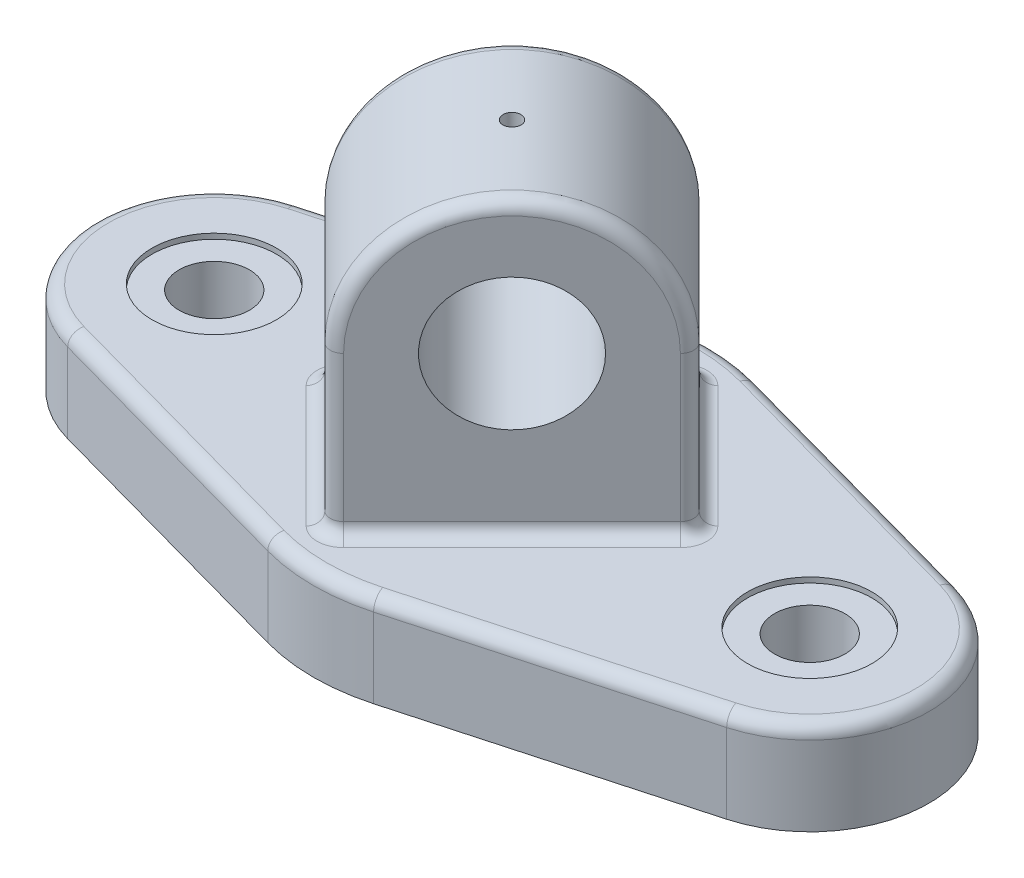
from build123d import *

# Parameters (mm, degrees)
BOSS_EXTRUDE1_DEPTH                                 = 17.78
CBORE_FOR_00_BINDING_HEAD_MACHINE_SCREW_D           = 13.4874
CBORE_FOR_00_BINDING_HEAD_MACHINE_SCREW_CBORE_D     = 23.876
CBORE_FOR_00_BINDING_HEAD_MACHINE_SCREW_CBORE_DEPTH = 1.016
BOSS_EXTRUDE3_DEPTH                                 = 19.05
SKETCH10_R                                          = 12.7
CUT_EXTRUDE1_DEPTH                                  = 19.05
F_29_0_136_DIAMETER_HOLE1_REACH                     = 117.235
F_29_0_136_DIAMETER_HOLE1_BORE_R                    = 1.7272
FILLET1_R                                           = 2.54
FILLET2_R                                           = 2.54
FILLET3_R                                           = 2.54
FILLET4_R                                           = 2.54
FILLET5_START                                       = -22.86
FILLET5_3_DEPTH                                     = 45.72


with BuildPart() as part:
    # Sketch1 → Boss-Extrude1 (new body)
    with BuildSketch(Plane(origin=(0, 0, 0), x_dir=(1, 0, 0), z_dir=(0, 1, 0))):
        with BuildLine():
            Line((63.246, 22.032212417), (10.16, 36.720354029))
            ThreePointArc((10.16, 36.720354029), (0, 38.1), (-10.16, 36.720354029))
            Line((-10.16, 36.720354029), (-63.246, 22.032212417))
            ThreePointArc((-63.246, 22.032212417), (-80.01, 0), (-63.246, -22.032212417))
            Line((-63.246, -22.032212417), (-10.16, -36.720354029))
            ThreePointArc((-10.16, -36.720354029), (0, -38.1), (10.16, -36.720354029))
            Line((10.16, -36.720354029), (63.246, -22.032212417))
            ThreePointArc((63.246, -22.032212417), (80.01, 0), (63.246, 22.032212417))
        make_face()
    extrude(amount=BOSS_EXTRUDE1_DEPTH)

    # CBORE for #00 Binding Head Machine Screw2 (through all)
    with Locations(Plane(origin=(0, 17.78, 0), x_dir=(1, 0, 0), z_dir=(0, 1, 0))):
        with Locations((-57.15, 0), (57.15, 0)):
            CounterBoreHole(CBORE_FOR_00_BINDING_HEAD_MACHINE_SCREW_D / 2, CBORE_FOR_00_BINDING_HEAD_MACHINE_SCREW_CBORE_D / 2, CBORE_FOR_00_BINDING_HEAD_MACHINE_SCREW_CBORE_DEPTH)

    # Sketch7 → Boss-Extrude3 (add, symmetric)
    with BuildSketch(Plane(origin=(0, 0, 0), x_dir=(0, -1, 0), z_dir=(0.7071067811865464, 0, 0.7071067811865488))):
        with BuildLine():
            Line((-48.26, -25.4), (-17.78, -25.4))
            Line((-17.78, -25.4), (-17.78, 25.4))
            Line((-17.78, 25.4), (-48.26, 25.4))
            ThreePointArc((-48.26, 25.4), (-73.66, 0), (-48.26, -25.4))
        make_face()
    extrude(amount=BOSS_EXTRUDE3_DEPTH, both=True)

    # Sketch10 → Cut-Extrude1 (cut, symmetric)
    with BuildSketch(Plane(origin=(0, 0, 0), x_dir=(0, -1, 0), z_dir=(0.7071067811865464, 0, 0.7071067811865488))):
        with Locations(Location((-48.26, 0, 0), (0, 0, 90))):
            Circle(SKETCH10_R)
    extrude(amount=CUT_EXTRUDE1_DEPTH, both=True, mode=Mode.SUBTRACT)

    # #29 (0.136) Diameter Hole1 bore (on position points) → #29 (0.136) Diameter Hole1 (cut, up to next)
    with BuildSketch(Plane.ZX.offset(73.66), mode=Mode.PRIVATE) as f_29_0_136_diameter_hole1_sk1:
        Circle(F_29_0_136_DIAMETER_HOLE1_BORE_R)
    f_29_0_136_diameter_hole1_tool1 = extrude(f_29_0_136_diameter_hole1_sk1.sketch, amount=-F_29_0_136_DIAMETER_HOLE1_REACH, mode=Mode.PRIVATE) & part.part
    add(f_29_0_136_diameter_hole1_tool1.solids().sort_by_distance((0, 73.66, 0))[0], mode=Mode.SUBTRACT)

    # Fillet1
    fillet1_edges = [part.edges().sort_by_distance(p)[0] for p in [
        (-36.703, 17.78, -29.376283223),
        (-80.01, 17.78, 0),
        (-36.703, 17.78, 29.376283223),
        (0, 17.78, 38.1),
        (36.703, 17.78, 29.376283223),
        (80.01, 17.78, 0),
        (36.703, 17.78, -29.376283223),
        (0, 17.78, -38.1),
    ]]
    fillet(fillet1_edges, radius=FILLET1_R)

    # Fillet2
    fillet2_edges = [part.edges().sort_by_distance(p)[0] for p in [
        (31.430896424, 33.02, -4.490128061),
        (-4.490128061, 33.02, 31.430896424),
        (13.470384182, 73.66, 13.470384182),
    ]]
    fillet(fillet2_edges, radius=FILLET2_R)

    # Fillet3
    fillet3_edges = [part.edges().sort_by_distance(p)[0] for p in [
        (17.06248663, 17.78, -18.858537854),
        (13.470384182, 17.78, 13.470384182),
        (-18.858537854, 17.78, 17.06248663),
        (30.378793975, 17.78, -4.490128061),
        (-4.490128061, 17.78, 30.378793975),
    ]]
    fillet(fillet3_edges, radius=FILLET3_R)

    # Fillet4
    # the kernel refuses this fillet: 2.54 mm, written as the material it takes off along each edge
    with BuildSketch(Plane(origin=(-33.226947648, 20.32, 6.286179285), x_dir=(-0.4226145849074772, 0.8017442392976469, 0.42261458490747583), z_dir=(0.5669187883846173, 0.5976672776328292, -0.5669187883846153))) as fillet4_piece_1_section:
        with BuildLine():
            CenterArc((2.54 + FILLET4_R, FILLET4_R), FILLET4_R, 180, 90)
            Line((2.54, FILLET4_R), (2.54, 0))
            Line((2.54, 0), (2.54 + FILLET4_R, 0))
        make_face()
    fillet4_piece_1 = revolve(axis=Axis((-33.226947648, 20.32, 6.286179285), (0.7071067811865464, 0, 0.7071067811865488)), revolution_arc=233.296989237, mode=Mode.PRIVATE)
    fillet4_piece_1 = split(fillet4_piece_1, bisect_by=Plane(origin=(-33.226947648, 17.78, 6.286179285), z_dir=(0, 1, 0)), keep=Keep.TOP, mode=Mode.PRIVATE)
    add(fillet4_piece_1, mode=Mode.SUBTRACT)
    with BuildSketch(Plane(origin=(6.286179285, 20.32, -33.226947648), x_dir=(0.4226145849074753, 0.8017442392976486, -0.42261458490747456), z_dir=(-0.5669187883846184, 0.597667277632827, 0.5669187883846165))) as fillet4_piece_2_section:
        with BuildLine():
            CenterArc((2.54 + FILLET4_R, -FILLET4_R), FILLET4_R, 90, 90)
            Line((2.54, -FILLET4_R), (2.54, 0))
            Line((2.54, 0), (2.54 + FILLET4_R, 0))
        make_face()
    fillet4_piece_2 = revolve(axis=Axis((6.286179285, 20.32, -33.226947648), (-0.7071067811865464, 0, -0.7071067811865488)), revolution_arc=233.296989237, mode=Mode.PRIVATE)
    fillet4_piece_2 = split(fillet4_piece_2, bisect_by=Plane(origin=(6.286179285, 17.78, -33.226947648), z_dir=(0, 1, 0)), keep=Keep.TOP, mode=Mode.PRIVATE)
    add(fillet4_piece_2, mode=Mode.SUBTRACT)
    with BuildSketch(Plane(origin=(-31.430896424, 48.26, 4.490128061), x_dir=(0.7071067811865488, 0, -0.7071067811865462), z_dir=(0, -1, 0)), Plane(origin=(4.490128061, 20.32, -31.430896424), x_dir=(-0.707106781186549, 0, 0.7071067811865461), z_dir=(0, 1, 0))) as fillet4_piece_3:
        with BuildLine():
            CenterArc((FILLET4_R, FILLET4_R), FILLET4_R, 180, 90)
            Line((0, FILLET4_R), (0, 0))
            Line((0, 0), (FILLET4_R, 0))
        make_face()
    extrude(amount=27.94, mode=Mode.SUBTRACT)
    with BuildSketch(Plane(origin=(-13.470384182, 48.26, -13.470384182), x_dir=(0.7071067811865487, 0, -0.7071067811865464), z_dir=(0, -1, 0))) as fillet4_piece_4:
        with BuildLine():
            CenterArc((25.4 - FILLET4_R, FILLET4_R), FILLET4_R, 270, 90)
            Line((25.4, FILLET4_R), (25.4, 0))
            Line((25.4, 0), (25.4 - FILLET4_R, 0))
        make_face()
    revolve(axis=Axis((-13.470384182, 48.26, -13.470384182), (0.7071067811865464, 0, 0.7071067811865488)), revolution_arc=180, mode=Mode.SUBTRACT)

    # Fillet5: read off the stored shape, not the designer's step
    # Fillet5 outline → Fillet5 (revolve)
    with BuildSketch(Plane(origin=(-27.838793975, 0, 4.490128061), x_dir=(1, 0, 0), z_dir=(0, 0, 1))):
        with BuildLine():
            ThreePointArc((5.08, 17.78), (3.283948776, 18.523948776), (2.54, 20.32))
            Line((2.54, 20.32), (2.54, 17.78))
            Line((2.54, 17.78), (5.08, 17.78))
        make_face()
    revolve(axis=Axis((-27.838793975, 0, 4.490128061), (0, 1, 0)))

    # Fillet5 2 outline → Fillet5 2 (revolve)
    with BuildSketch(Plane(origin=(4.490128061, 0, -27.838793975), x_dir=(1, 0, 0), z_dir=(0, 0, 1))):
        with BuildLine():
            ThreePointArc((5.08, 17.78), (3.283948776, 18.523948776), (2.54, 20.32))
            Line((2.54, 20.32), (2.54, 17.78))
            Line((2.54, 17.78), (5.08, 17.78))
        make_face()
    revolve(axis=Axis((4.490128061, 0, -27.838793975), (0, 1, 0)))

    # Fillet5 3 outline → Fillet5 3 (add)
    with BuildSketch(Plane(origin=(0, 0, 0), x_dir=(0.707106781186546, 0, 0.707106781186549), z_dir=(0.707106781186549, 0, -0.707106781186546)).offset(FILLET5_START)):
        with BuildLine():
            ThreePointArc((-21.59, -17.78), (-19.793948776, -18.523948776), (-19.05, -20.32))
            Line((-19.05, -20.32), (-19.05, -17.78))
            Line((-19.05, -17.78), (-21.59, -17.78))
        make_face()
    extrude(amount=FILLET5_3_DEPTH)


solid = part.part
